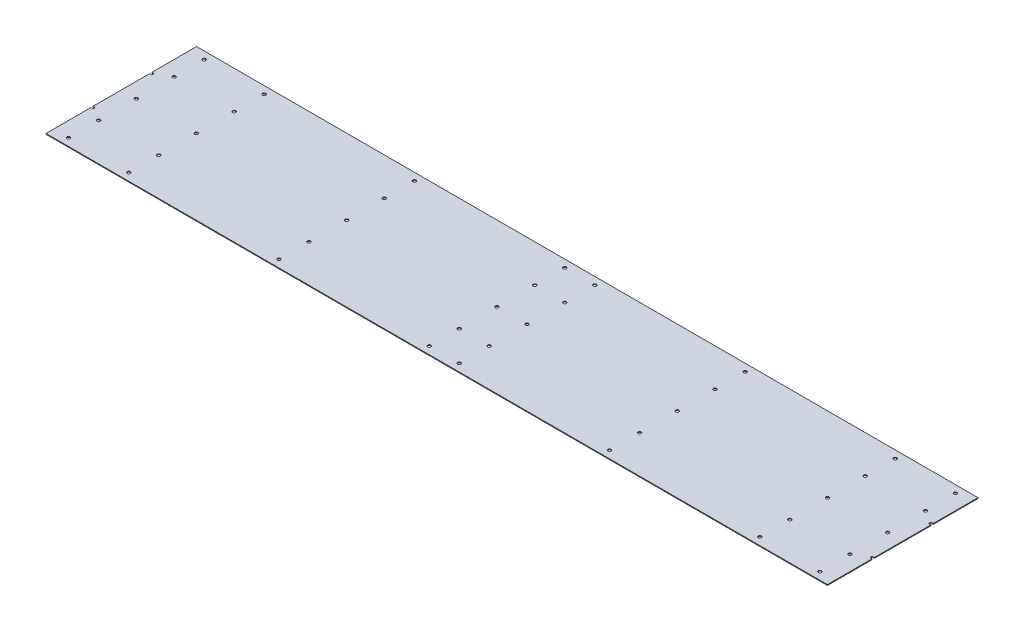
from build123d import *

# Parameters (mm, degrees)
SKETCH1_R           = 2.15
BOSS_EXTRUDE1_DEPTH = 1


with BuildPart() as part:
    # Sketch1 → Boss-Extrude1 (new body)
    with BuildSketch(Plane(origin=(0, 0, 0), x_dir=(1, 0, 0), z_dir=(0, 1, 0))):
        Polygon((-497, -40.7), (-500, -40.7), (-500, -100.2), (540, -100.2), (540, -40.7), (537, -40.7), (537, -37.7), (540, -37.7), (540, 37.7), (537, 37.7), (537, 40.7), (540, 40.7), (540, 100.2), (-500, 100.2), (-500, 40.7), (-497, 40.7), (-497, 37.7), (-500, 37.7), (-500, -37.7), (-497, -37.7), align=None)
        with Locations((-480, -90.2)):
            Circle(SKETCH1_R, mode=Mode.SUBTRACT)
        with Locations((-400, -90.2)):
            Circle(SKETCH1_R, mode=Mode.SUBTRACT)
        with Locations((-480, -50.2)):
            Circle(SKETCH1_R, mode=Mode.SUBTRACT)
        with Locations((-400, -50.2)):
            Circle(SKETCH1_R, mode=Mode.SUBTRACT)
        with Locations((-200, -90.2)):
            Circle(SKETCH1_R, mode=Mode.SUBTRACT)
        with Locations((0, -90.2)):
            Circle(SKETCH1_R, mode=Mode.SUBTRACT)
        with Locations((-200, -50.2)):
            Circle(SKETCH1_R, mode=Mode.SUBTRACT)
        with Locations((0, -50.2)):
            Circle(SKETCH1_R, mode=Mode.SUBTRACT)
        with Locations((-480, 0)):
            Circle(SKETCH1_R, mode=Mode.SUBTRACT)
        with Locations((-400, 0)):
            Circle(SKETCH1_R, mode=Mode.SUBTRACT)
        with Locations((-200, 0)):
            Circle(SKETCH1_R, mode=Mode.SUBTRACT)
        Circle(SKETCH1_R, mode=Mode.SUBTRACT)
        with Locations((40, -90.2)):
            Circle(SKETCH1_R, mode=Mode.SUBTRACT)
        with Locations((240, -90.2)):
            Circle(SKETCH1_R, mode=Mode.SUBTRACT)
        with Locations((40, -50.2)):
            Circle(SKETCH1_R, mode=Mode.SUBTRACT)
        with Locations((240, -50.2)):
            Circle(SKETCH1_R, mode=Mode.SUBTRACT)
        with Locations((440, -90.2)):
            Circle(SKETCH1_R, mode=Mode.SUBTRACT)
        with Locations((520, -90.2)):
            Circle(SKETCH1_R, mode=Mode.SUBTRACT)
        with Locations((440, -50.2)):
            Circle(SKETCH1_R, mode=Mode.SUBTRACT)
        with Locations((520, -50.2)):
            Circle(SKETCH1_R, mode=Mode.SUBTRACT)
        with Locations((40, 0)):
            Circle(SKETCH1_R, mode=Mode.SUBTRACT)
        with Locations((240, 0)):
            Circle(SKETCH1_R, mode=Mode.SUBTRACT)
        with Locations((440, 0)):
            Circle(SKETCH1_R, mode=Mode.SUBTRACT)
        with Locations((520, 0)):
            Circle(SKETCH1_R, mode=Mode.SUBTRACT)
        with Locations((-480, 50.2)):
            Circle(SKETCH1_R, mode=Mode.SUBTRACT)
        with Locations((-400, 50.2)):
            Circle(SKETCH1_R, mode=Mode.SUBTRACT)
        with Locations((-480, 90.2)):
            Circle(SKETCH1_R, mode=Mode.SUBTRACT)
        with Locations((-400, 90.2)):
            Circle(SKETCH1_R, mode=Mode.SUBTRACT)
        with Locations((-200, 50.2)):
            Circle(SKETCH1_R, mode=Mode.SUBTRACT)
        with Locations((0, 50.2)):
            Circle(SKETCH1_R, mode=Mode.SUBTRACT)
        with Locations((-200, 90.2)):
            Circle(SKETCH1_R, mode=Mode.SUBTRACT)
        with Locations((0, 90.2)):
            Circle(SKETCH1_R, mode=Mode.SUBTRACT)
        with Locations((40, 50.2)):
            Circle(SKETCH1_R, mode=Mode.SUBTRACT)
        with Locations((240, 50.2)):
            Circle(SKETCH1_R, mode=Mode.SUBTRACT)
        with Locations((40, 90.2)):
            Circle(SKETCH1_R, mode=Mode.SUBTRACT)
        with Locations((240, 90.2)):
            Circle(SKETCH1_R, mode=Mode.SUBTRACT)
        with Locations((440, 50.2)):
            Circle(SKETCH1_R, mode=Mode.SUBTRACT)
        with Locations((520, 50.2)):
            Circle(SKETCH1_R, mode=Mode.SUBTRACT)
        with Locations((440, 90.2)):
            Circle(SKETCH1_R, mode=Mode.SUBTRACT)
        with Locations((520, 90.2)):
            Circle(SKETCH1_R, mode=Mode.SUBTRACT)
    extrude(amount=BOSS_EXTRUDE1_DEPTH)


solid = part.part
